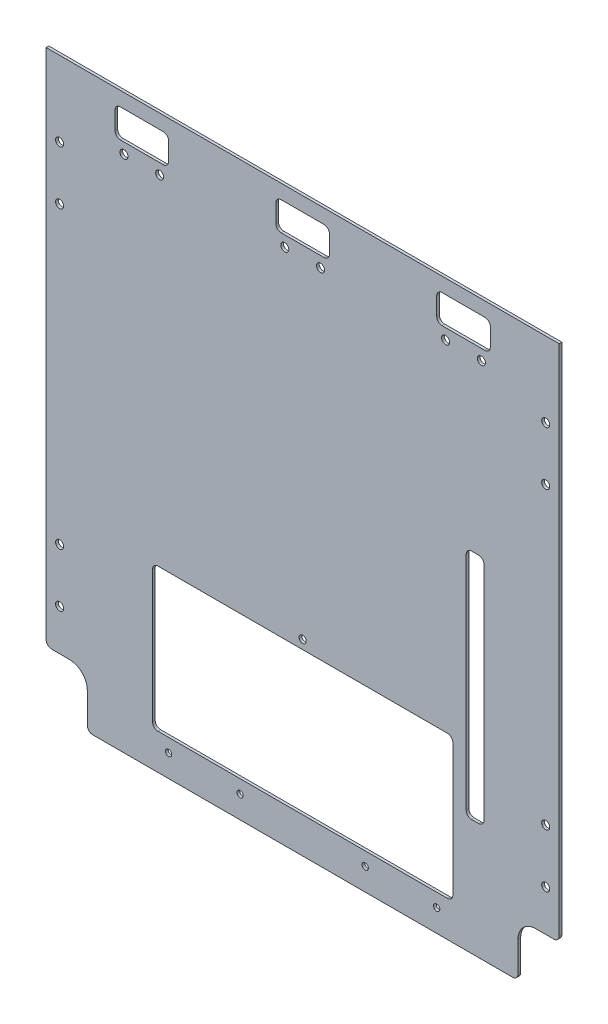
from build123d import *

# Parameters (mm, degrees)
ESQUISSE1_W                  = 287
ESQUISSE1_H                  = 320
BOSS_EXTRU_1_DEPTH           = 1.5
ENL_V_MAT_EXTRU_1_DEPTH      = 430.850264627
ENL_V_MAT_EXTRU_1_DEPTH_BACK = 430.850264627
ESQUISSE2_W                  = 23
ESQUISSE2_H                  = 30
CONG_1_R                     = 10
CONG_2_R                     = 3
ENL_V_MAT_EXTRU_2_DEPTH      = 430.850264627
ENL_V_MAT_EXTRU_2_DEPTH_BACK = 430.850264627
ESQUISSE3_W                  = 10
ESQUISSE3_H                  = 130
ENL_V_MAT_EXTRU_3_DEPTH      = 430.850264627
ENL_V_MAT_EXTRU_3_DEPTH_BACK = 430.850264627
ESQUISSE4_W                  = 168
ESQUISSE4_H                  = 80
CONG_3_R                     = 3
ENL_V_MAT_EXTRU_4_DEPTH      = 430.850264627
ENL_V_MAT_EXTRU_4_DEPTH_BACK = 430.850264627
ESQUISSE5_R                  = 2
ESQUISSE5_R_2                = 1.75
ENL_V_MAT_EXTRU_5_DEPTH      = 430.850264627
ENL_V_MAT_EXTRU_5_DEPTH_BACK = 430.850264627
ESQUISSE6_R                  = 2.25
ENL_V_MAT_EXTRU_6_DEPTH      = 430.850264627
ENL_V_MAT_EXTRU_6_DEPTH_BACK = 430.850264627
ESQUISSE7_W                  = 30
ESQUISSE7_H                  = 16
CONG_4_R                     = 3


with BuildPart() as part:
    # Esquisse1 → Boss.-Extru.1 (new body)
    with BuildSketch(Plane.XY):
        with Locations((143.5, 160)):
            Rectangle(ESQUISSE1_W, ESQUISSE1_H)
    extrude(amount=BOSS_EXTRU_1_DEPTH)

    # Esquisse2 → Enlèv. mat.-Extru.1 (cut, two sides: drawn at the far end of the back side and taken through both)
    with BuildSketch(Plane.XY.offset(1.5).offset(-ENL_V_MAT_EXTRU_1_DEPTH_BACK)):
        with Locations((275.5, 15)):
            Rectangle(ESQUISSE2_W, ESQUISSE2_H)
        with Locations((11.5, 15)):
            Rectangle(ESQUISSE2_W, ESQUISSE2_H)
    extrude(amount=ENL_V_MAT_EXTRU_1_DEPTH + ENL_V_MAT_EXTRU_1_DEPTH_BACK, mode=Mode.SUBTRACT)

    # Congé1
    cong_1_edges = [part.edges().sort_by_distance(p)[0] for p in [
        (23, 30, 0.75),
        (264, 30, 0.75),
    ]]
    fillet(cong_1_edges, radius=CONG_1_R)

    # Congé2
    cong_2_edges = [part.edges().sort_by_distance(p)[0] for p in [
        (264, 0, 0.75),
        (287, 30, 0.75),
        (23, 0, 0.75),
        (0, 30, 0.75),
    ]]
    fillet(cong_2_edges, radius=CONG_2_R)

    # Esquisse3 → Enlèv. mat.-Extru.2 (cut, two sides: drawn at the far end of the back side and taken through both)
    with BuildSketch(Plane.XY.offset(1.5).offset(-ENL_V_MAT_EXTRU_2_DEPTH_BACK)):
        with Locations((240, 130)):
            Rectangle(ESQUISSE3_W, ESQUISSE3_H)
    extrude(amount=ENL_V_MAT_EXTRU_2_DEPTH + ENL_V_MAT_EXTRU_2_DEPTH_BACK, mode=Mode.SUBTRACT)

    # Esquisse4 → Enlèv. mat.-Extru.3 (cut, two sides: drawn at the far end of the back side and taken through both)
    with BuildSketch(Plane.XY.offset(1.5).offset(-ENL_V_MAT_EXTRU_3_DEPTH_BACK)):
        with Locations((143.5, 60)):
            Rectangle(ESQUISSE4_W, ESQUISSE4_H)
    extrude(amount=ENL_V_MAT_EXTRU_3_DEPTH + ENL_V_MAT_EXTRU_3_DEPTH_BACK, mode=Mode.SUBTRACT)

    # Congé3
    cong_3_edges = [part.edges().sort_by_distance(p)[0] for p in [
        (235, 195, 0.75),
        (245, 195, 0.75),
        (245, 65, 0.75),
        (235, 65, 0.75),
        (227.5, 20, 0.75),
        (227.5, 100, 0.75),
        (59.5, 100, 0.75),
        (59.5, 20, 0.75),
    ]]
    fillet(cong_3_edges, radius=CONG_3_R)

    # Esquisse5 → Enlèv. mat.-Extru.4 (cut, two sides: drawn at the far end of the back side and taken through both)
    with BuildSketch(Plane.XY.offset(1.5).offset(-ENL_V_MAT_EXTRU_4_DEPTH_BACK)):
        with Locations((143.5, 105)):
            Circle(ESQUISSE5_R)
        with Locations((68.5, 12.5)):
            Circle(ESQUISSE5_R_2)
        with Locations((108.5, 12.5)):
            Circle(ESQUISSE5_R_2)
        with Locations((178.5, 12.5)):
            Circle(ESQUISSE5_R_2)
        with Locations((218.5, 12.5)):
            Circle(ESQUISSE5_R_2)
    extrude(amount=ENL_V_MAT_EXTRU_4_DEPTH + ENL_V_MAT_EXTRU_4_DEPTH_BACK, mode=Mode.SUBTRACT)

    # Esquisse6 → Enlèv. mat.-Extru.5 (cut, two sides: drawn at the far end of the back side and taken through both)
    with BuildSketch(Plane.XY.offset(1.5).offset(-ENL_V_MAT_EXTRU_5_DEPTH_BACK)):
        with Locations((279.5, 83)):
            Circle(ESQUISSE6_R)
        with Locations((279.5, 53)):
            Circle(ESQUISSE6_R)
        with Locations((279.5, 278)):
            Circle(ESQUISSE6_R)
        with Locations((279.5, 248)):
            Circle(ESQUISSE6_R)
        with Locations((7.5, 248)):
            Circle(ESQUISSE6_R)
        with Locations((7.5, 278)):
            Circle(ESQUISSE6_R)
        with Locations((7.5, 53)):
            Circle(ESQUISSE6_R)
        with Locations((7.5, 83)):
            Circle(ESQUISSE6_R)
        with Locations((133.5, 290)):
            Circle(ESQUISSE6_R)
        with Locations((153.5, 290)):
            Circle(ESQUISSE6_R)
        with Locations((43.5, 290)):
            Circle(ESQUISSE6_R)
        with Locations((63.5, 290)):
            Circle(ESQUISSE6_R)
        with Locations((223.5, 290)):
            Circle(ESQUISSE6_R)
        with Locations((243.5, 290)):
            Circle(ESQUISSE6_R)
    extrude(amount=ENL_V_MAT_EXTRU_5_DEPTH + ENL_V_MAT_EXTRU_5_DEPTH_BACK, mode=Mode.SUBTRACT)

    # Esquisse7 → Enlèv. mat.-Extru.6 (cut, two sides: drawn at the far end of the back side and taken through both)
    with BuildSketch(Plane.XY.offset(1.5).offset(-ENL_V_MAT_EXTRU_6_DEPTH_BACK)):
        with Locations((143.5, 304)):
            Rectangle(ESQUISSE7_W, ESQUISSE7_H)
        with Locations((53.5, 304)):
            Rectangle(ESQUISSE7_W, ESQUISSE7_H)
        with Locations((233.5, 304)):
            Rectangle(ESQUISSE7_W, ESQUISSE7_H)
    extrude(amount=ENL_V_MAT_EXTRU_6_DEPTH + ENL_V_MAT_EXTRU_6_DEPTH_BACK, mode=Mode.SUBTRACT)

    # Congé4
    cong_4_edges = [part.edges().sort_by_distance(p)[0] for p in [
        (218.5, 296, 0.75),
        (248.5, 296, 0.75),
        (248.5, 312, 0.75),
        (218.5, 312, 0.75),
        (128.5, 312, 0.75),
        (158.5, 312, 0.75),
        (128.5, 296, 0.75),
        (158.5, 296, 0.75),
        (68.5, 296, 0.75),
        (68.5, 312, 0.75),
        (38.5, 312, 0.75),
        (38.5, 296, 0.75),
    ]]
    fillet(cong_4_edges, radius=CONG_4_R)


solid = part.part
